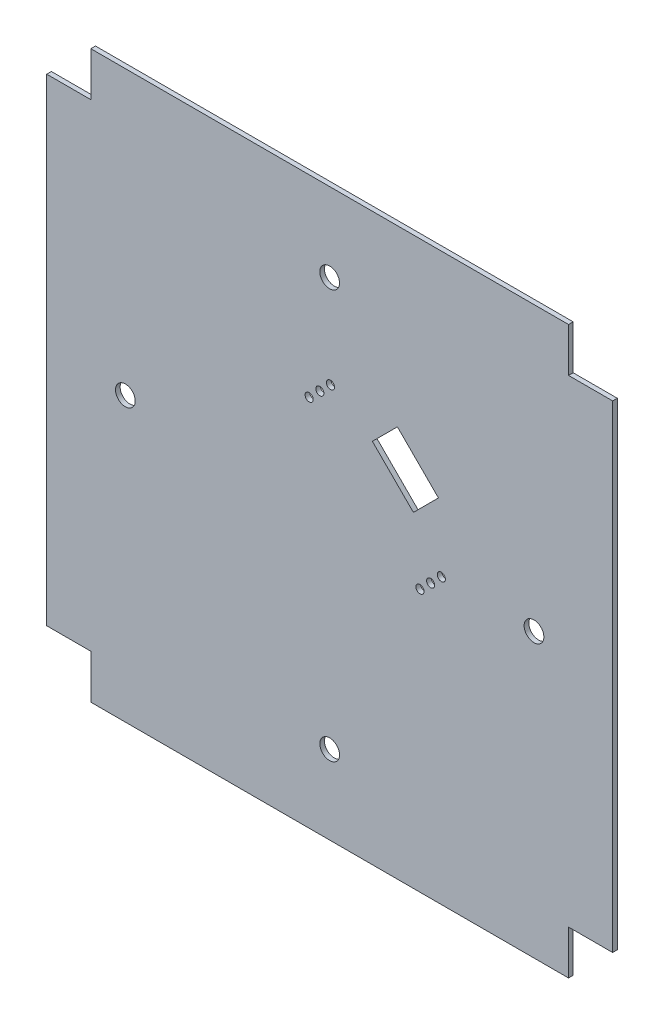
from build123d import *

# Parameters (mm, degrees)
SKETCH1_W           = 97.5
SKETCH1_H           = 97.5
BOSS_EXTRUDE1_DEPTH = 0.8
SKETCH2_W           = 7.6
SKETCH2_H           = 7.6
CUT_EXTRUDE1_DEPTH  = 69.947552531
SKETCH3_R           = 1.7
CUT_EXTRUDE2_DEPTH  = 69.947552531
CUT_EXTRUDE3_DEPTH  = 69.947552531
SKETCH5_R           = 0.7
CUT_EXTRUDE4_DEPTH  = 69.947552531


with BuildPart() as part:
    # Sketch1 → Boss-Extrude1 (new body)
    with BuildSketch(Plane.XY):
        Rectangle(SKETCH1_W, SKETCH1_H)
    extrude(amount=BOSS_EXTRUDE1_DEPTH)

    # Sketch2 → Cut-Extrude1 (cut, through all)
    with BuildSketch(Plane(origin=(0, 0, 0), x_dir=(-1, 0, 0), z_dir=(0, 0, -1))):
        with Locations((-44.95, 44.95)):
            Rectangle(SKETCH2_W, SKETCH2_H)
        with Locations((-44.95, -44.95)):
            Rectangle(SKETCH2_W, SKETCH2_H)
        with Locations((44.95, -44.95)):
            Rectangle(SKETCH2_W, SKETCH2_H)
        with Locations((44.95, 44.95)):
            Rectangle(SKETCH2_W, SKETCH2_H)
    extrude(amount=-CUT_EXTRUDE1_DEPTH, mode=Mode.SUBTRACT)

    # Sketch3 → Cut-Extrude2 (cut, through all)
    with BuildSketch(Plane(origin=(0, 0, 0), x_dir=(-1, 0, 0), z_dir=(0, 0, -1))):
        with Locations((0, 35.2)):
            Circle(SKETCH3_R)
        with Locations((35.2, 0)):
            Circle(SKETCH3_R)
        with Locations((0, -35.2)):
            Circle(SKETCH3_R)
        with Locations((-35.2, 0)):
            Circle(SKETCH3_R)
    extrude(amount=-CUT_EXTRUDE2_DEPTH, mode=Mode.SUBTRACT)

    # Sketch4 → Cut-Extrude3 (cut, through all)
    with BuildSketch(Plane(origin=(0, 0, 0), x_dir=(-1, 0, 0), z_dir=(0, 0, -1))):
        Polygon((-18.738329701, 11.66726189), (-14.424978336, 7.353910524), (-7.353910524, 14.424978336), (-11.66726189, 18.738329701), align=None)
    extrude(amount=-CUT_EXTRUDE3_DEPTH, mode=Mode.SUBTRACT)

    # Sketch5 → Cut-Extrude4 (cut, through all)
    with BuildSketch(Plane(origin=(0, 0, 0), x_dir=(-1, 0, 0), z_dir=(0, 0, -1))):
        with Locations((-0.141421356, 19.233304448)):
            Circle(SKETCH5_R)
        with Locations((1.697056275, 17.394826817)):
            Circle(SKETCH5_R)
        with Locations((3.535533906, 15.556349186)):
            Circle(SKETCH5_R)
        with Locations((-19.233304448, 0.141421356)):
            Circle(SKETCH5_R)
        with Locations((-17.394826817, -1.697056275)):
            Circle(SKETCH5_R)
        with Locations((-15.556349186, -3.535533906)):
            Circle(SKETCH5_R)
    extrude(amount=-CUT_EXTRUDE4_DEPTH, mode=Mode.SUBTRACT)


solid = part.part
